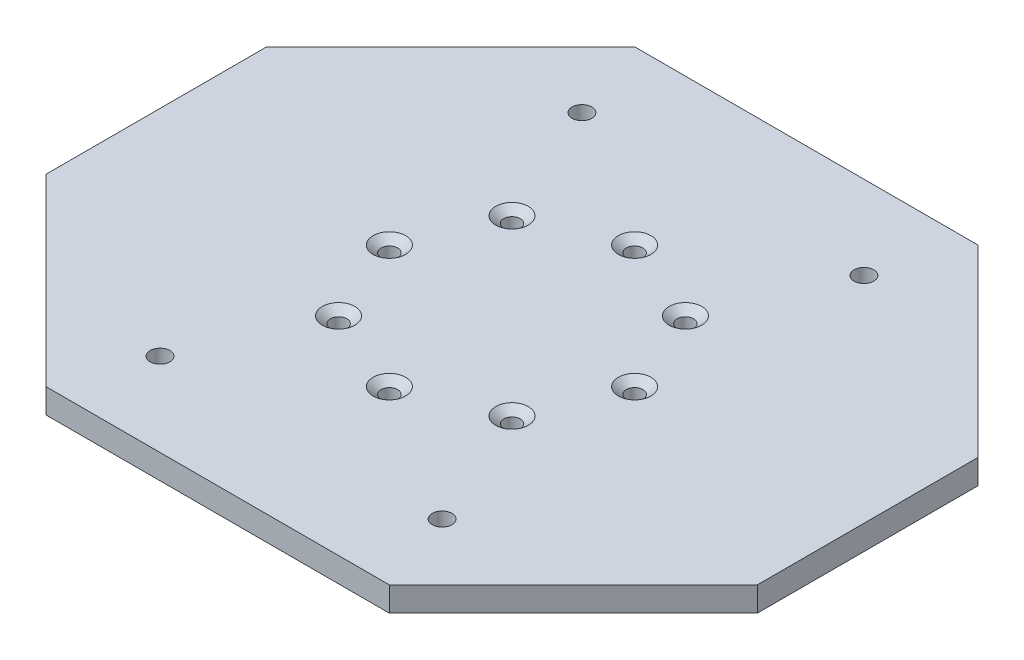
from build123d import *

# Parameters (mm, degrees)
BOSS_EXTRUDE1_DEPTH                               = 6.35
F_7_0_201_DIAMETER_HOLE1_D                        = 5.1054
CIRPATTERN1_COUNT                                 = 2
CSK_FOR_8_FLAT_HEAD_MACHINE_SCREW_100_D           = 4.3053
CSK_FOR_8_FLAT_HEAD_MACHINE_SCREW_100_CSINK_D     = 8.4328
CSK_FOR_8_FLAT_HEAD_MACHINE_SCREW_100_CSINK_ANGLE = 100
CIRPATTERN2_COUNT                                 = 8


with BuildPart() as part:
    # Sketch1 → Boss-Extrude1 (new body)
    with BuildSketch(Plane(origin=(0, 0, 0), x_dir=(1, 0, 0), z_dir=(0, 1, 0))):
        Polygon((-92.075, 28.575), (-44.45, 76.2), (44.45, 76.2), (92.075, 28.575), (92.075, -28.575), (44.45, -76.2), (-44.45, -76.2), (-92.075, -28.575), align=None)
    extrude(amount=BOSS_EXTRUDE1_DEPTH)

    # #7 (0.201) Diameter Hole1 (through all)
    with Locations(Plane(origin=(0, 6.35, 0), x_dir=(-1, 0, 0), z_dir=(0, 1, 0))):
        with Locations((36.5125, -54.61), (-36.5125, -54.61)):
            f_7_0_201_diameter_hole1 = Hole(F_7_0_201_DIAMETER_HOLE1_D / 2)

    # CirPattern1: #7 (0.201) Diameter Hole1 ×2 about axis
    cirpattern1_axis = Axis((0, 0, 0), (0, 1, 0))
    for i in range(1, CIRPATTERN1_COUNT):
        add(f_7_0_201_diameter_hole1.rotate(cirpattern1_axis, i * 360 / CIRPATTERN1_COUNT), mode=Mode.SUBTRACT)

    # CSK for #8 Flat Head Machine Screw (100)1 (through all)
    with Locations(Plane(origin=(0, 6.35, 0), x_dir=(-1, 0, 0), z_dir=(0, 1, 0))):
        with Locations((0, 31.75)):
            csk_for_8_flat_head_machine_screw_100 = CounterSinkHole(CSK_FOR_8_FLAT_HEAD_MACHINE_SCREW_100_D / 2, CSK_FOR_8_FLAT_HEAD_MACHINE_SCREW_100_CSINK_D / 2, counter_sink_angle=CSK_FOR_8_FLAT_HEAD_MACHINE_SCREW_100_CSINK_ANGLE)

    # CirPattern2: CSK for #8 Flat Head Machine Screw (100)1 ×8 about axis
    cirpattern2_axis = Axis((0, 0, 0), (0, 1, 0))
    for i in range(1, CIRPATTERN2_COUNT):
        add(csk_for_8_flat_head_machine_screw_100.rotate(cirpattern2_axis, i * 360 / CIRPATTERN2_COUNT), mode=Mode.SUBTRACT)


solid = part.part
